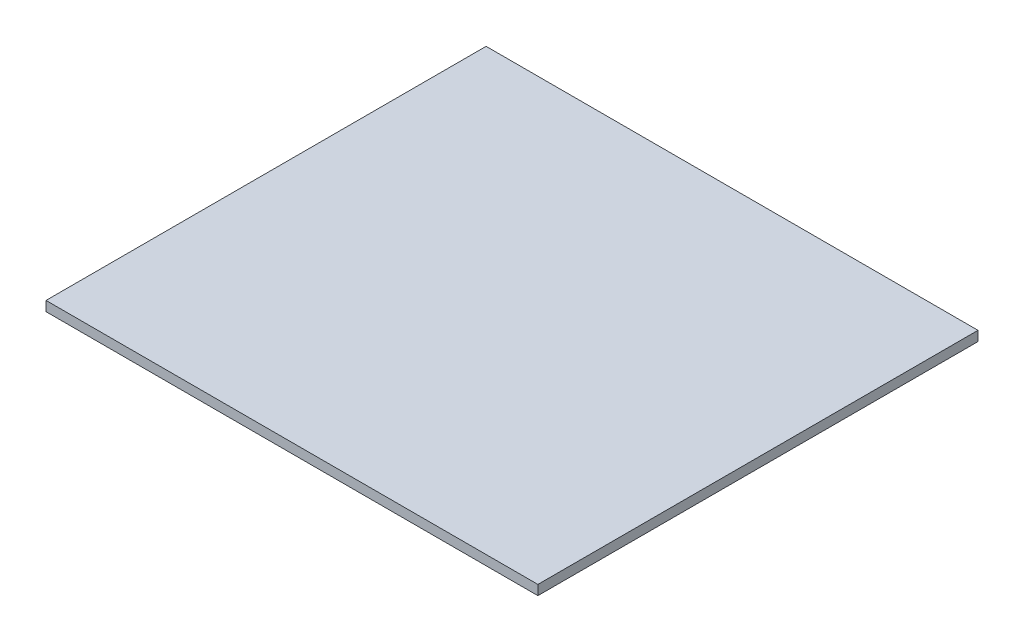
from build123d import *

# Parameters (mm, degrees)
SKETCH1_W           = 302.4
SKETCH1_H           = 270.57
BOSS_EXTRUDE1_DEPTH = 6


with BuildPart() as part:
    # Sketch1 → Boss-Extrude1 (new body)
    with BuildSketch(Plane(origin=(0, 0, 0), x_dir=(1, 0, 0), z_dir=(0, 1, 0))):
        with Locations((151.2, 135.285)):
            Rectangle(SKETCH1_W, SKETCH1_H)
    extrude(amount=BOSS_EXTRUDE1_DEPTH)


solid = part.part
